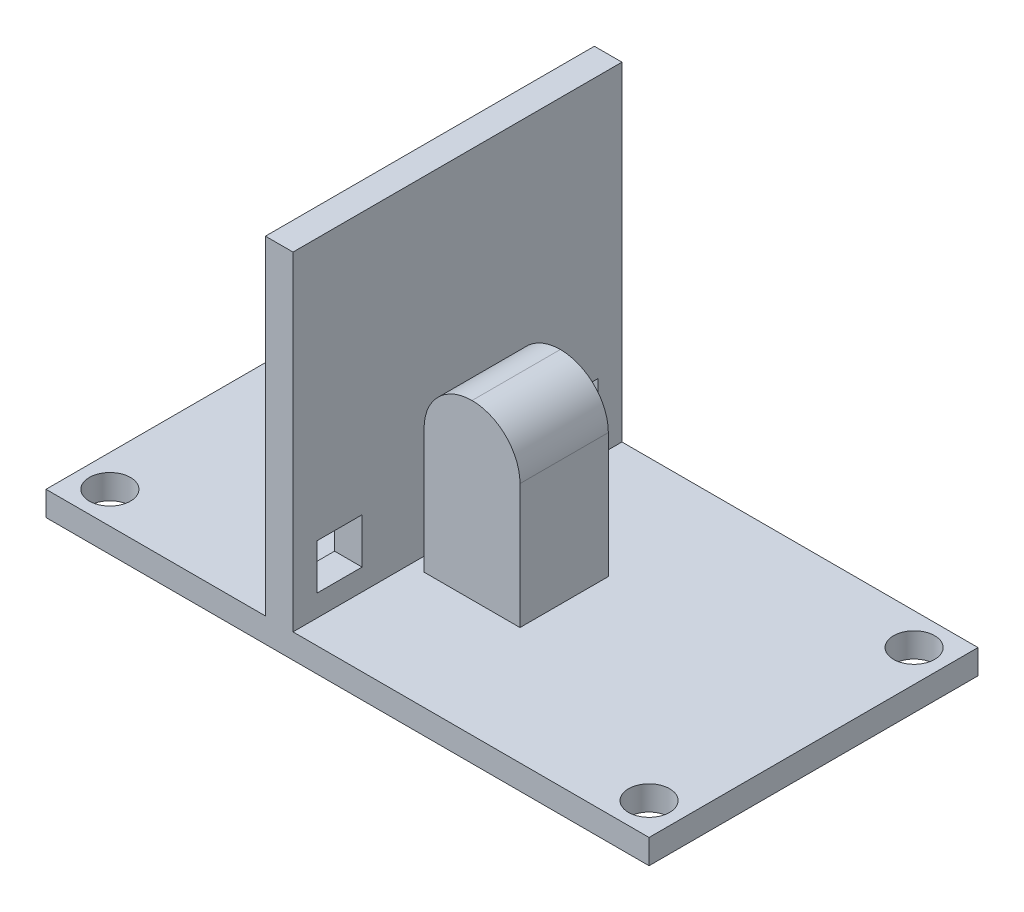
from build123d import *

# Parameters (mm, degrees)
SKETCH1_W           = 69.85
SKETCH1_H           = 38.1
BOSS_EXTRUDE1_DEPTH = 2.84
SKETCH2_W           = 11.1125
SKETCH2_H           = 10.23
BOSS_EXTRUDE5_DEPTH = 20
SKETCH4_W           = 3.192184281
SKETCH4_H           = 38.1
BOSS_EXTRUDE7_DEPTH = 38.1
FILLET1_R           = 5.55625
FILLET2_R           = 5.55625
SKETCH5_W           = 8
SKETCH5_H           = 14.5
CUT_EXTRUDE1_DEPTH  = 38.1
SKETCH6_W           = 5.25
SKETCH6_H           = 5.25
CUT_EXTRUDE2_DEPTH  = 10
SKETCH7_W           = 5.253
SKETCH7_H           = 5.25
CUT_EXTRUDE3_DEPTH  = 10
SKETCH8_R           = 2.38125
CUT_EXTRUDE4_DEPTH  = 10
SKETCH9_R           = 2.38125
CUT_EXTRUDE5_DEPTH  = 10
SKETCH10_W          = 4.5
SKETCH10_H          = 14.5
CUT_EXTRUDE6_DEPTH  = 10
SKETCH12_R          = 2.38125
CUT_EXTRUDE7_DEPTH  = 10
SKETCH13_R          = 2.38125
CUT_EXTRUDE8_DEPTH  = 10


with BuildPart() as part:
    # Sketch1 → Boss-Extrude1 (new body)
    with BuildSketch(Plane(origin=(0, 0, 0), x_dir=(1, 0, 0), z_dir=(0, 1, 0))):
        with Locations((-22.809987281, -11.136378688)):
            Rectangle(SKETCH1_W, SKETCH1_H)
    extrude(amount=BOSS_EXTRUDE1_DEPTH)

    # Sketch2 → Boss-Extrude5 (add)
    with BuildSketch(Plane(origin=(0, 2.84, 0), x_dir=(1, 0, 0), z_dir=(0, 1, 0))):
        with Locations((-21.968737281, -11.491378688)):
            Rectangle(SKETCH2_W, SKETCH2_H)
    extrude(amount=BOSS_EXTRUDE5_DEPTH)

    # Sketch4 → Boss-Extrude7 (add)
    with BuildSketch(Plane(origin=(0, 2.84, 0), x_dir=(1, 0, 0), z_dir=(0, 1, 0))):
        with Locations((-30.721079422, -11.136378688)):
            Rectangle(SKETCH4_W, SKETCH4_H)
    extrude(amount=BOSS_EXTRUDE7_DEPTH)

    # Fillet1
    fillet1_edges = [part.edges().sort_by_distance(p)[0] for p in [
        (-16.412487281, 22.84, 11.491378688),
    ]]
    fillet(fillet1_edges, radius=FILLET1_R)

    # Fillet2
    fillet2_edges = [part.edges().sort_by_distance(p)[0] for p in [
        (-27.524987281, 22.84, 11.491378688),
    ]]
    fillet(fillet2_edges, radius=FILLET2_R - 0.0001)  # a hair under: the kernel refuses the full size

    # Sketch5 → Cut-Extrude1 (cut)
    with BuildSketch(Plane(origin=(0, 2.84, 0), x_dir=(1, 0, 0), z_dir=(0, 1, 0))):
        with Locations((-40.817171562, -10.386378688)):
            Rectangle(SKETCH5_W, SKETCH5_H)
    extrude(amount=-CUT_EXTRUDE1_DEPTH, mode=Mode.SUBTRACT)

    # Sketch6 → Cut-Extrude2 (cut)
    with BuildSketch(Plane(origin=(-29.124987281, 0, 0), x_dir=(0, 0, -1), z_dir=(1, 0, 0))):
        with Locations((2.538621312, 7.965)):
            Rectangle(SKETCH6_W, SKETCH6_H)
    extrude(amount=-CUT_EXTRUDE2_DEPTH, mode=Mode.SUBTRACT)

    # Sketch7 → Cut-Extrude3 (cut)
    with BuildSketch(Plane(origin=(-29.124987281, 0, 0), x_dir=(0, 0, -1), z_dir=(1, 0, 0))):
        with Locations((-24.809878688, 7.965)):
            Rectangle(SKETCH7_W, SKETCH7_H)
    extrude(amount=-CUT_EXTRUDE3_DEPTH, mode=Mode.SUBTRACT)

    # Sketch8 → Cut-Extrude4 (cut)
    with BuildSketch(Plane(origin=(0, 2.84, 0), x_dir=(1, 0, 0), z_dir=(0, 1, 0))):
        with Locations(Location((8.415012719, 4.213621312, 0), (0, 0, 270))):
            Circle(SKETCH8_R)
    extrude(amount=-CUT_EXTRUDE4_DEPTH, mode=Mode.SUBTRACT)

    # Sketch9 → Cut-Extrude5 (cut)
    with BuildSketch(Plane(origin=(0, 2.84, 0), x_dir=(1, 0, 0), z_dir=(0, 1, 0))):
        with Locations(Location((8.415012719, -26.486378688, 0), (0, 0, 270))):
            Circle(SKETCH9_R)
    extrude(amount=-CUT_EXTRUDE5_DEPTH, mode=Mode.SUBTRACT)

    # Sketch10 → Cut-Extrude6 (cut)
    with BuildSketch(Plane(origin=(0, 2.84, 0), x_dir=(1, 0, 0), z_dir=(0, 1, 0))):
        with Locations((-34.567171562, -10.386378688)):
            Rectangle(SKETCH10_W, SKETCH10_H)
    extrude(amount=-CUT_EXTRUDE6_DEPTH, mode=Mode.SUBTRACT)

    # Sketch12 → Cut-Extrude7 (cut)
    with BuildSketch(Plane(origin=(0, 2.84, 0), x_dir=(1, 0, 0), z_dir=(0, 1, 0))):
        with Locations(Location((-54.034987281, -26.486378688, 0), (0, 0, 270))):
            Circle(SKETCH12_R)
    extrude(amount=-CUT_EXTRUDE7_DEPTH, mode=Mode.SUBTRACT)

    # Sketch13 → Cut-Extrude8 (cut)
    with BuildSketch(Plane(origin=(0, 2.84, 0), x_dir=(1, 0, 0), z_dir=(0, 1, 0))):
        with Locations(Location((-54.034987281, 4.213621312, 0), (0, 0, 270))):
            Circle(SKETCH13_R)
    extrude(amount=-CUT_EXTRUDE8_DEPTH, mode=Mode.SUBTRACT)


solid = part.part
